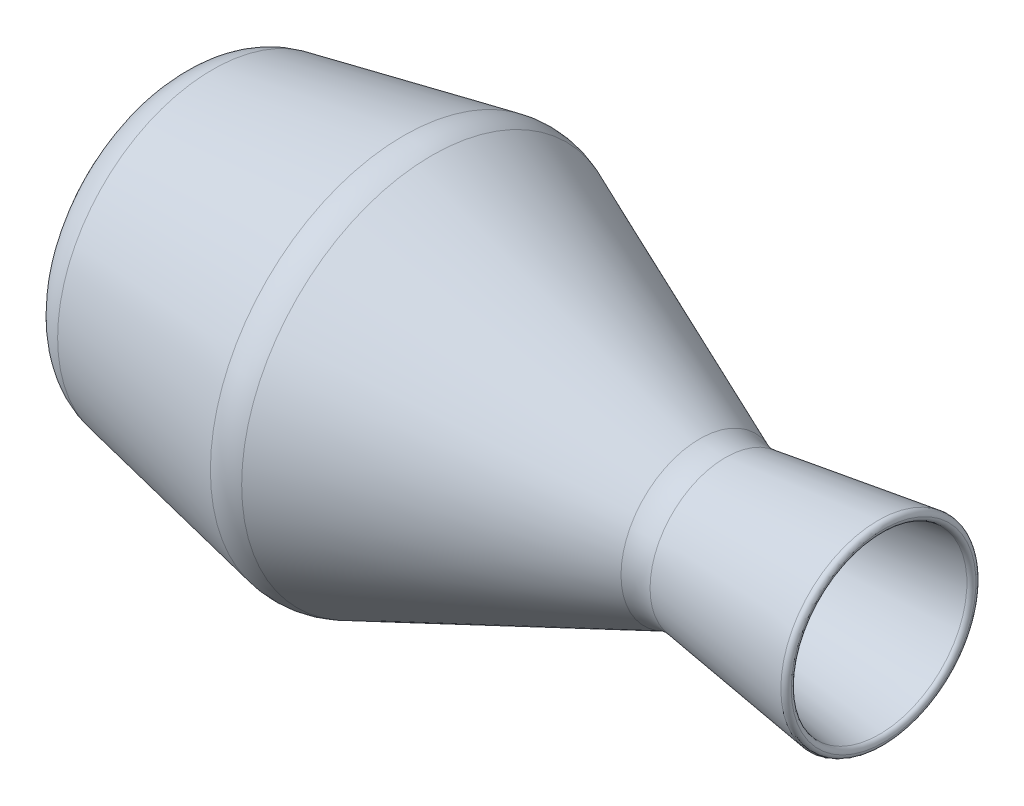
from build123d import *

# Parameters (mm, degrees)
FILLET_1_R = 1
FILLET_4_R = 10


with BuildPart() as part:
    # 스케치2 → 회전5 (revolve)
    with BuildSketch(Plane(origin=(0, 0, 0), x_dir=(1, 0, 0), z_dir=(0, 1, 0)), mode=Mode.PRIVATE) as revolve_5_sk:
        Polygon((-78.828533155, 4.583054253), (-78.828533155, 34.583054253), (-28.828533155, 44.583054253), (31.171466845, 19.583054253), (66.171466845, 24.583054253), (66.171466845, 22.562749164), (64.171466845, 22.277034878), (30.909884451, 17.525380251), (-29.034574551, 42.502238168), (-76.828533155, 32.943446448), (-76.828533155, 4.583054253), align=None)
    revolve(revolve_5_sk.sketch.rotate(Axis((-92.184862693, 0, -4.583054253), (1, 0, 0)), 180), axis=Axis((-92.184862693, 0, -4.583054253), (1, 0, 0)))

    # 필렛1
    fillet_1_edges = [part.edges().sort_by_distance(p)[0] for p in [
        (66.171466845, 0, -22.562749164),
        (66.171466845, 0, -24.583054253),
    ]]
    fillet(fillet_1_edges, radius=FILLET_1_R - 0.0001)  # a hair under: the kernel refuses the full size

    # 필렛4
    fillet_4_edges = [part.edges().sort_by_distance(p)[0] for p in [
        (-76.828533155, 0, -32.943446448),
        (-29.034574551, 0, -42.502238168),
        (30.909884451, 0, -17.525380251),
        (31.171466845, 0, -19.583054253),
        (-28.828533155, 0, -44.583054253),
        (-78.828533155, 0, -34.583054253),
    ]]
    fillet(fillet_4_edges, radius=FILLET_4_R)


solid = part.part
